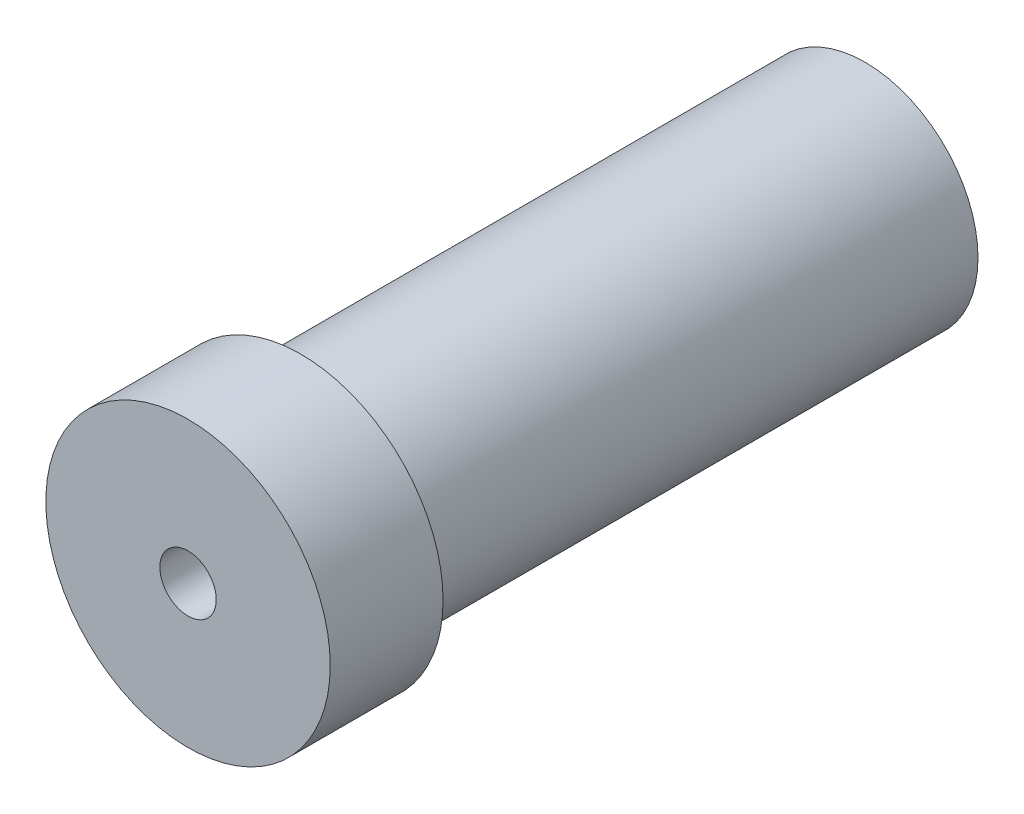
from build123d import *

# Parameters (mm, degrees)
SKETCH3_R           = 16.002
SKETCH3_R_2         = 3.175
BOSS_EXTRUDE1_DEPTH = 12.7
CUT_EXTRUDE2_DEPTH  = 4.064
SKETCH4_R           = 12.7
SKETCH4_R_2         = 9.525
BOSS_EXTRUDE2_DEPTH = 63.5


with BuildPart() as part:
    # Sketch3 → Boss-Extrude1 (new body)
    with BuildSketch(Plane.XY):
        Circle(SKETCH3_R)
        Circle(SKETCH3_R_2, mode=Mode.SUBTRACT)
    extrude(amount=BOSS_EXTRUDE1_DEPTH)

    # Sketch5 → Cut-Extrude2 (cut)
    with BuildSketch(Plane(origin=(0, 0, 0), x_dir=(-1, 0, 0), z_dir=(0, 0, -1))):
        Polygon((0, 6.415804866), (-5.55625, 3.207902433), (-5.55625, -3.207902433), (0, -6.415804866), (5.55625, -3.207902433), (5.55625, 3.207902433), align=None)
    extrude(amount=-CUT_EXTRUDE2_DEPTH, mode=Mode.SUBTRACT)

    # Sketch4 → Boss-Extrude2 (add)
    with BuildSketch(Plane(origin=(0, 0, 0), x_dir=(-1, 0, 0), z_dir=(0, 0, -1))):
        Circle(SKETCH4_R)
        Circle(SKETCH4_R_2, mode=Mode.SUBTRACT)
    extrude(amount=BOSS_EXTRUDE2_DEPTH)


solid = part.part
